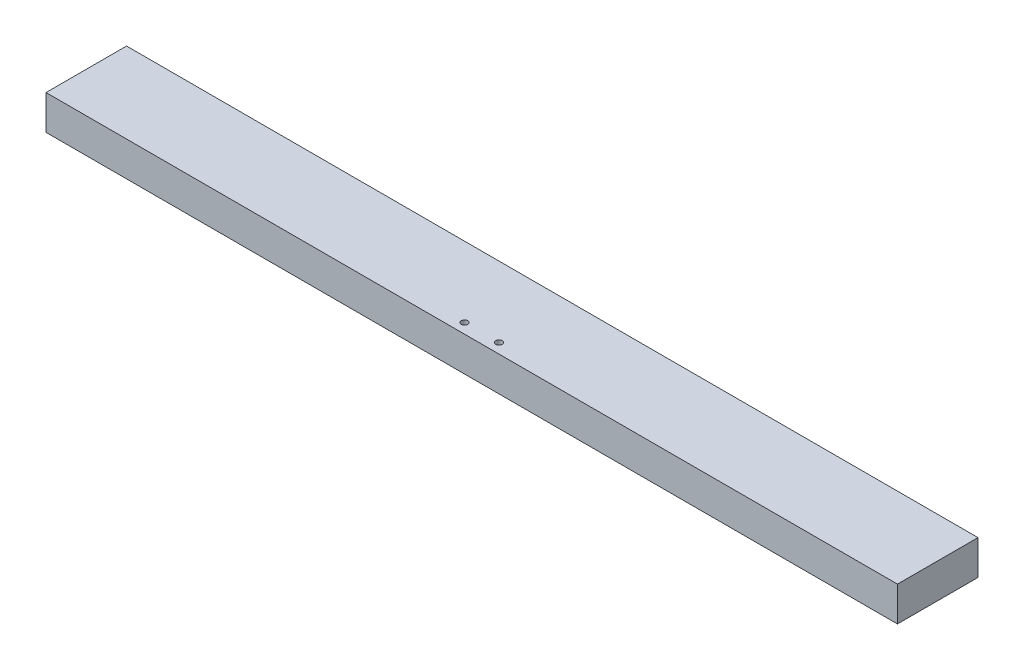
from build123d import *

# Parameters (mm, degrees)
SKETCH1_W           = 939.6984
SKETCH1_H           = 38.1
BOSS_EXTRUDE1_DEPTH = 88.9
SKETCH2_R           = 3.571875
CUT_EXTRUDE1_DEPTH  = 480.701043089


with BuildPart() as part:
    # Sketch1 → Boss-Extrude1 (new body)
    with BuildSketch(Plane.XY):
        Rectangle(SKETCH1_W, SKETCH1_H)
    extrude(amount=BOSS_EXTRUDE1_DEPTH)

    # Sketch2 → Cut-Extrude1 (cut, through all)
    with BuildSketch(Plane(origin=(0, 19.05, 0), x_dir=(1, 0, 0), z_dir=(0, 1, 0))):
        with Locations((-19.05, -77.7875)):
            Circle(SKETCH2_R)
        with Locations((19.05, -77.7875)):
            Circle(SKETCH2_R)
    extrude(amount=-CUT_EXTRUDE1_DEPTH, mode=Mode.SUBTRACT)


solid = part.part
